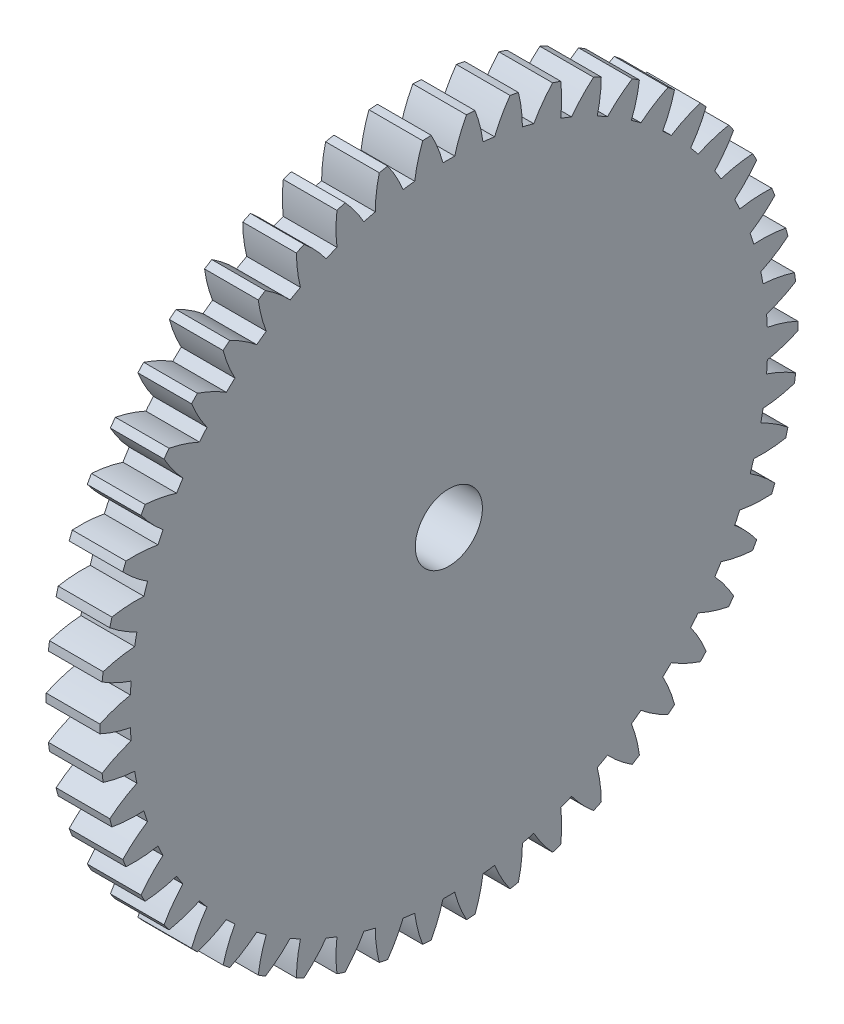
from build123d import *

# Parameters (mm, degrees)
BASPROSKE_W     = 4
BASPROSKE_H     = 26
TOOTHCUT_DEPTH  = 37.986484018
TEETHCUTS_COUNT = 50
TEETHCUTS_ANGLE = 352.8
BORSKE_R        = 2.5
BORE_DEPTH      = 50.0000508


with BuildPart() as part:
    # BasProSke → Base-Revolve (revolve)
    with BuildSketch(Plane(origin=(0, 0, 0), x_dir=(1, 0, 0), z_dir=(0, 1, 0))):
        with Locations((2, 13)):
            Rectangle(BASPROSKE_W, BASPROSKE_H)
    revolve(axis=Axis((-10, 0, 0), (1, 0, 0)))

    # TooCutSke → ToothCut (cut, through all)
    with BuildSketch(Plane(origin=(0, 0, 0), x_dir=(0, 0, -1), z_dir=(1, 0, 0))):
        with BuildLine():
            ThreePointArc((0.437663408, 23.744966872), (0, 23.749), (-0.437663408, 23.744966872))
            ThreePointArc((-0.437663408, 23.744966872), (-0.815428123, 24.895236298), (-1.329433358, 25.991422664))
            ThreePointArc((-1.329433358, 25.991422664), (0, 26.0254), (1.329433358, 25.991422664))
            ThreePointArc((1.329433358, 25.991422664), (0.815428123, 24.895236298), (0.437663408, 23.744966872))
        make_face()
    toothcut = extrude(amount=TOOTHCUT_DEPTH, mode=Mode.SUBTRACT)

    # TeethCuts: ToothCut ×50 about axis
    teethcuts_axis = Axis((-10, 0, 0), (1, 0, 0))
    for i in range(1, TEETHCUTS_COUNT):
        add(toothcut.rotate(teethcuts_axis, i * TEETHCUTS_ANGLE / (TEETHCUTS_COUNT - 1)), mode=Mode.SUBTRACT)

    # BorSke → Bore (cut, symmetric)
    with BuildSketch(Plane(origin=(0, 0, 0), x_dir=(0, 0, -1), z_dir=(1, 0, 0))):
        Circle(BORSKE_R)
    extrude(amount=BORE_DEPTH, both=True, mode=Mode.SUBTRACT)


solid = part.part
